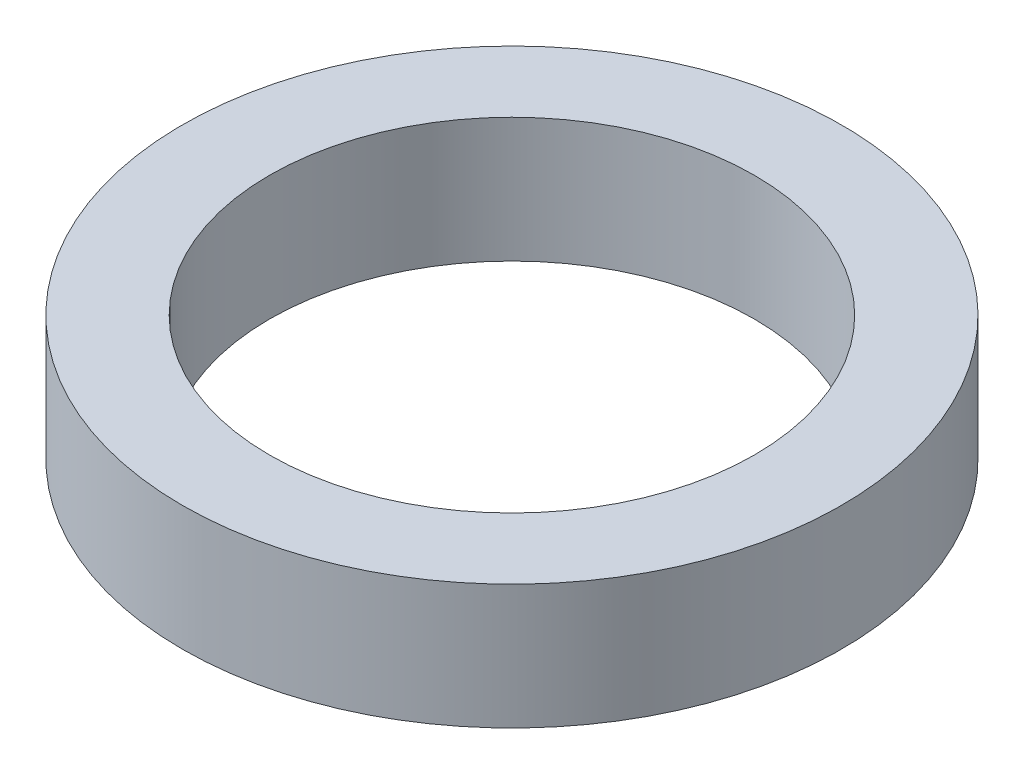
from build123d import *

# Parameters (mm, degrees)
SKETCH1_R           = 317.5
BOSS_EXTRUDE1_DEPTH = 120
SKETCH2_R           = 233.5
CUT_EXTRUDE1_DEPTH  = 465.771449209


with BuildPart() as part:
    # Sketch1 → Boss-Extrude1 (new body)
    with BuildSketch(Plane(origin=(0, 0, 0), x_dir=(1, 0, 0), z_dir=(0, 1, 0))):
        Circle(SKETCH1_R)
    extrude(amount=BOSS_EXTRUDE1_DEPTH)

    # Sketch2 → Cut-Extrude1 (cut, through all)
    with BuildSketch(Plane(origin=(0, 120, 0), x_dir=(1, 0, 0), z_dir=(0, 1, 0))):
        Circle(SKETCH2_R)
    extrude(amount=-CUT_EXTRUDE1_DEPTH, mode=Mode.SUBTRACT)


solid = part.part
